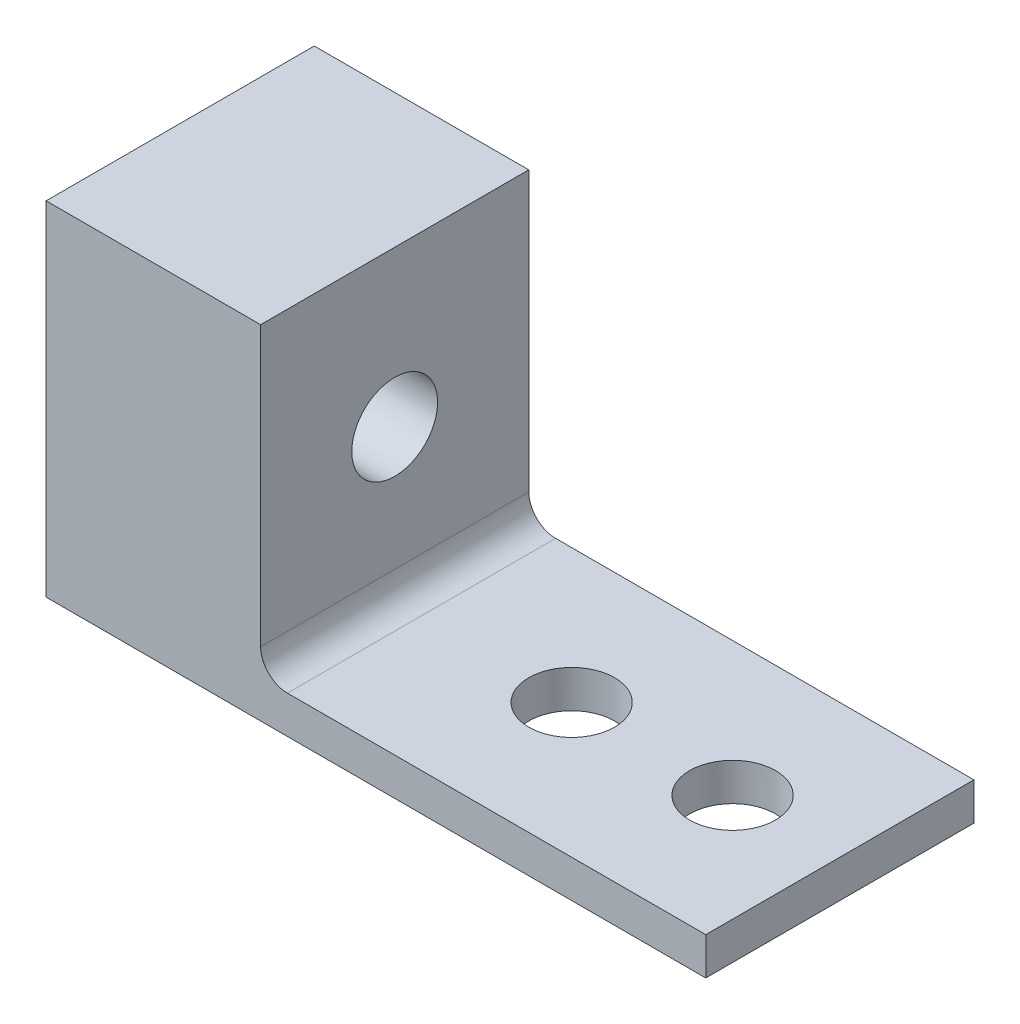
from build123d import *

# Parameters (mm, degrees)
BOSS_EXTRUDE1_DEPTH = 6.35
CUT_EXTRUDE1_REACH  = 37.786
SKETCH2_R           = 2.032
CUT_EXTRUDE2_REACH  = 37.786
SKETCH3_R           = 2.032
FILLET2_R           = 1.27
LPATTERN1_COUNT     = 2
LPATTERN1_PITCH     = 7.62


with BuildPart() as part:
    # Sketch1 → Boss-Extrude1 (new, symmetric)
    with BuildSketch(Plane.XY):
        Polygon((0, 0), (0, 16.256), (10.16, 16.256), (10.16, 1.778), (31.242, 1.778), (31.242, 0), align=None)
    extrude(amount=BOSS_EXTRUDE1_DEPTH, both=True)

    # Sketch2 → Cut-Extrude1 (cut, up to next)
    with BuildSketch(Plane.ZY, mode=Mode.PRIVATE) as cut_extrude1_sk1:
        with Locations((0, 8.89)):
            Circle(SKETCH2_R)
    cut_extrude1_tool1 = extrude(cut_extrude1_sk1.sketch, amount=-CUT_EXTRUDE1_REACH, mode=Mode.PRIVATE) & part.part
    add(cut_extrude1_tool1.solids().sort_by_distance((0, 8.89, 0))[0], mode=Mode.SUBTRACT)

    # Sketch3 → Cut-Extrude2 (cut, up to next)
    with BuildSketch(Plane.XZ, mode=Mode.PRIVATE) as cut_extrude2_sk1:
        with Locations((18.542, 0)):
            Circle(SKETCH3_R)
    cut_extrude2_tool1 = extrude(cut_extrude2_sk1.sketch, amount=-CUT_EXTRUDE2_REACH, mode=Mode.PRIVATE) & part.part
    cut_extrude2 = cut_extrude2_tool1.solids().sort_by_distance((18.542, 0, 0))[0]
    add(cut_extrude2, mode=Mode.SUBTRACT)

    # Fillet2
    fillet2_edges = [part.edges().sort_by_distance(p)[0] for p in [
        (10.16, 1.778, 0),
    ]]
    fillet(fillet2_edges, radius=FILLET2_R)

    # LPattern1: Cut-Extrude2 ×2
    with Locations(*[(i * LPATTERN1_PITCH, 0, 0) for i in range(1, LPATTERN1_COUNT)]):
        add(cut_extrude2, mode=Mode.SUBTRACT)


solid = part.part
